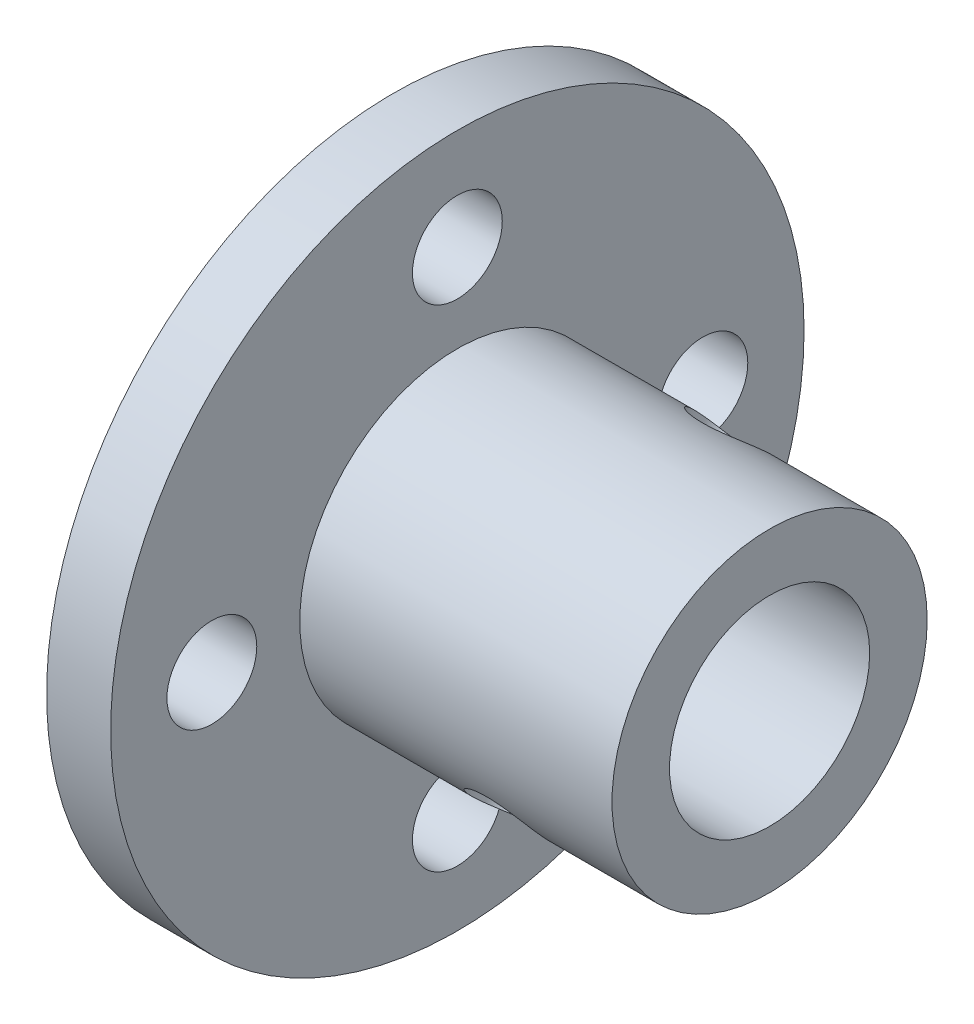
from build123d import *

# Parameters (mm, degrees)
PIN_CUT_DEPTH      = 20.609075552
PIN_CUT_DEPTH_BACK = 20.609075552
SKETCH3_R          = 1.2446
SKETCH2_R          = 1.425
CUT_EXTRUDE2_DEPTH = 20.609075613


with BuildPart() as part:
    # Sketch1 → Revolve1 (revolve)
    with BuildSketch(Plane.XY):
        Polygon((0, 3.175), (0, 5), (-9.906, 5), (-9.906, 11), (-11.938, 11), (-11.938, 3.175), align=None)
    revolve(axis=Axis((0, 0, 0), (-1, 0, 0)))

    # Sketch3 → Pin Cut (cut, two sides: drawn at the far end of the back side and taken through both)
    with BuildSketch(Plane(origin=(0, 0, 0), x_dir=(1, 0, 0), z_dir=(0, 0.7071067811865464, -0.7071067811865488)).offset(-PIN_CUT_DEPTH_BACK)):
        with Locations((-4.6736, 0)):
            Circle(SKETCH3_R)
    extrude(amount=PIN_CUT_DEPTH + PIN_CUT_DEPTH_BACK, mode=Mode.SUBTRACT)

    # Sketch2 → Cut-Extrude2 (cut, through all)
    with BuildSketch(Plane.ZY.offset(11.938)):
        with Locations((-7.78885, 0)):
            Circle(SKETCH2_R)
        with Locations((0, 7.78885)):
            Circle(SKETCH2_R)
        with Locations((7.78885, 0)):
            Circle(SKETCH2_R)
        with Locations((0, -7.78885)):
            Circle(SKETCH2_R)
    extrude(amount=-CUT_EXTRUDE2_DEPTH, mode=Mode.SUBTRACT)


solid = part.part
